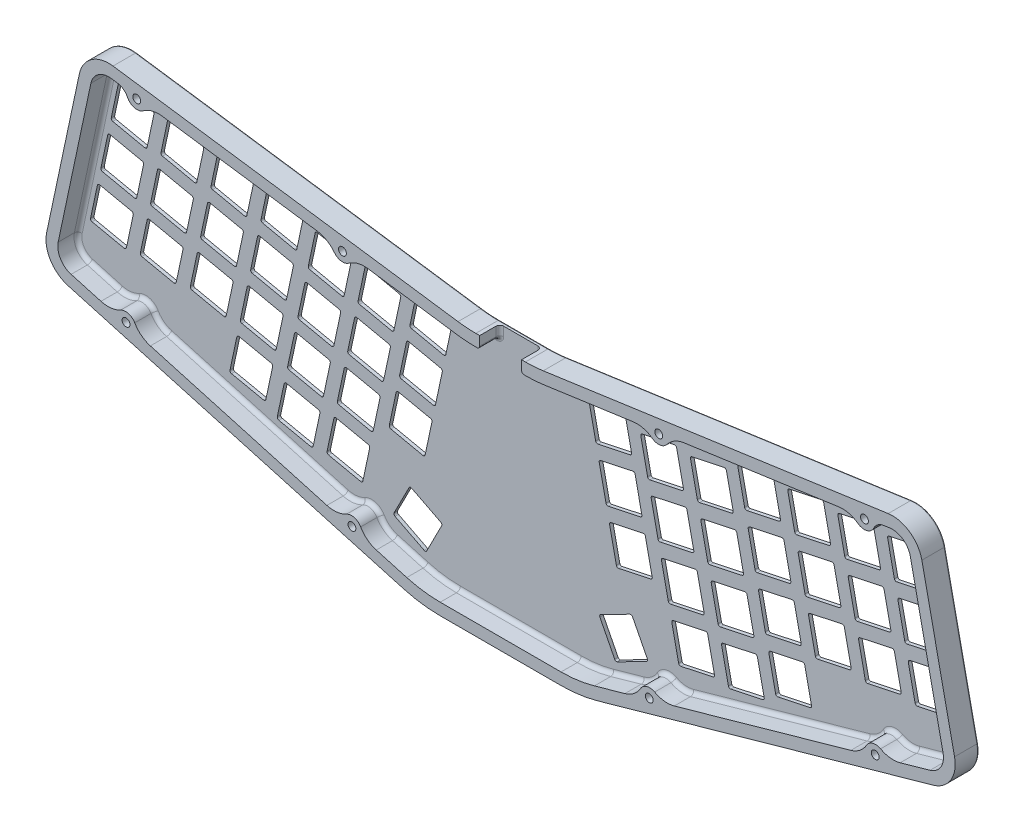
from build123d import *

# Parameters (mm, degrees)
MODEL_R             = 1.5
BOSS_EXTRUDE1_DEPTH = 9
BOSS_EXTRUDE2_DEPTH = 1.3
MODEL_4_R           = 1.5
BOSS_EXTRUDE3_DEPTH = 2
CUT_EXTRUDE1_DEPTH  = 10
FILLET2_R           = 1
FILLET3_R           = 1
FILLET4_R           = 1.5
FILLET6_R           = 0.5


with BuildPart() as part:
    # Model → Boss-Extrude1 (new body)
    with BuildSketch(Plane.XY):
        with BuildLine():
            ThreePointArc((176.403737975, 57.612801897), (173.012294783, 57.253677545), (169.603999044, 57.1337718))
            Line((169.603999044, 57.1337718), (150.648829756, 57.1337718))
            ThreePointArc((150.648829756, 57.1337718), (147.240534017, 57.253677545), (143.849090824, 57.612801897))
            Line((143.849090824, 57.612801897), (12.081352867, 76.271030157))
            ThreePointArc((12.081352867, 76.271030157), (3.877804033, 74.308284837), (-0.779653775, 67.275599046))
            Line((-0.779653775, 67.275599046), (-13.274730709, 8.490883588))
            ThreePointArc((-13.274730709, 8.490883588), (-11.871459071, 0.157038619), (-5.151125733, -4.967340667))
            Line((-5.151125733, -4.967340667), (123.055393281, -41.169431628))
            ThreePointArc((123.055393281, -41.169431628), (129.986107868, -42.620640598), (137.050372447, -43.1074446))
            Line((137.050372447, -43.1074446), (183.202456353, -43.1074446))
            ThreePointArc((183.202456353, -43.1074446), (190.266720932, -42.620640598), (197.197435519, -41.169431628))
            Line((197.197435519, -41.169431628), (325.403954533, -4.967340667))
            ThreePointArc((325.403954533, -4.967340667), (332.124287871, 0.157038619), (333.527559509, 8.490883588))
            Line((333.527559509, 8.490883588), (321.032482575, 67.275599045))
            ThreePointArc((321.032482575, 67.275599045), (316.375024767, 74.308284836), (308.171475933, 76.271030156))
            Line((308.171475933, 76.271030156), (176.403737975, 57.612801897))
        make_face()
        with Locations((103.335575354, -30.405568574)):
            Circle(MODEL_R, mode=Mode.SUBTRACT)
        with Locations((17.039281052, -6.037803815)):
            Circle(MODEL_R, mode=Mode.SUBTRACT)
        with Locations((216.917253446, -30.405568574)):
            Circle(MODEL_R, mode=Mode.SUBTRACT)
        with Locations((303.213547748, -6.037803815)):
            Circle(MODEL_R, mode=Mode.SUBTRACT)
        with Locations((21.146353911, 69.937554571)):
            Circle(MODEL_R, mode=Mode.SUBTRACT)
        with Locations((99.718342652, 58.811810716)):
            Circle(MODEL_R, mode=Mode.SUBTRACT)
        with BuildLine():
            Line((124.278255538, -36.838772567), (112.628950613, -33.549320519))
            ThreePointArc((112.628950613, -33.549320519), (109.193120681, -31.80832864), (106.670193349, -28.897861715))
            ThreePointArc((106.670193349, -28.897861715), (104.286690443, -27.037278193), (101.282051153, -27.376394512))
            ThreePointArc((101.282051153, -27.376394512), (97.609446415, -28.537408934), (93.770452927, -28.224185309))
            Line((93.770452927, -28.224185309), (26.332656311, -9.18155576))
            ThreePointArc((26.332656311, -9.18155576), (22.896826379, -7.440563881), (20.373899046, -4.530096956))
            ThreePointArc((20.373899046, -4.530096956), (17.99039614, -2.669513434), (14.98575685, -3.008629753))
            ThreePointArc((14.98575685, -3.008629753), (11.313152113, -4.169644175), (7.474158624, -3.85642055))
            Line((7.474158624, -3.85642055), (-3.928263476, -0.636681606))
            ThreePointArc((-3.928263476, -0.636681606), (-8.01890116, 2.482505785), (-8.873066505, 7.555280983))
            Line((-8.873066505, 7.555280983), (3.622010429, 66.339996442))
            ThreePointArc((3.622010429, 66.339996442), (6.456984747, 70.620761706), (11.450449255, 71.815476249))
            Line((11.450449255, 71.815476249), (13.807051559, 71.481782855))
            ThreePointArc((13.807051559, 71.481782855), (16.05801748, 70.566743382), (17.611829082, 68.698638909))
            ThreePointArc((17.611829082, 68.698638909), (20.250303311, 66.551050421), (23.587647853, 67.21121251))
            ThreePointArc((23.587647853, 67.21121251), (27.071325394, 68.854371308), (30.917639732, 69.058934404))
            Line((30.917639732, 69.058934404), (90.087257633, 60.680553975))
            ThreePointArc((90.087257633, 60.680553975), (93.725570339, 59.416172428), (96.616102068, 56.870429634))
            ThreePointArc((96.616102068, 56.870429634), (99.227639842, 55.346379898), (102.159636594, 56.085468655))
            ThreePointArc((102.159636594, 56.085468655), (105.643314135, 57.728627453), (109.489628473, 57.933190549))
            Line((109.489628473, 57.933190549), (143.218187212, 53.157247988))
            ThreePointArc((143.218187212, 53.157247988), (146.924300392, 52.76480282), (150.648829756, 52.6337718))
            Line((150.648829756, 52.6337718), (169.603999044, 52.6337718))
            ThreePointArc((169.603999044, 52.6337718), (173.328528408, 52.76480282), (177.034641588, 53.157247988))
            Line((177.034641588, 53.157247988), (210.763200327, 57.933190549))
            ThreePointArc((210.763200327, 57.933190549), (214.609514665, 57.728627453), (218.093192206, 56.085468655))
            ThreePointArc((218.093192206, 56.085468655), (221.025188958, 55.346379898), (223.636726732, 56.870429634))
            ThreePointArc((223.636726732, 56.870429634), (226.52725846, 59.416172428), (230.165571167, 60.680553974))
            Line((230.165571167, 60.680553974), (289.335189068, 69.058934403))
            ThreePointArc((289.335189068, 69.058934403), (293.181503406, 68.854371307), (296.665180948, 67.211212509))
            ThreePointArc((296.665180948, 67.211212509), (300.002525489, 66.55105042), (302.640999718, 68.698638908))
            ThreePointArc((302.640999718, 68.698638908), (304.19481132, 70.566743381), (306.445777241, 71.481782853))
            Line((306.445777241, 71.481782853), (308.802379545, 71.815476247))
            ThreePointArc((308.802379545, 71.815476247), (313.795844053, 70.620761705), (316.630818371, 66.339996441))
            Line((316.630818371, 66.339996441), (329.125895305, 7.555280983))
            ThreePointArc((329.125895305, 7.555280983), (328.27172996, 2.482505785), (324.181092276, -0.636681606))
            Line((324.181092276, -0.636681606), (312.778670176, -3.85642055))
            ThreePointArc((312.778670176, -3.85642055), (308.939676687, -4.169644175), (305.26707195, -3.008629753))
            ThreePointArc((305.26707195, -3.008629753), (302.26243266, -2.669513434), (299.878929754, -4.530096956))
            ThreePointArc((299.878929754, -4.530096956), (297.356002421, -7.440563881), (293.920172489, -9.18155576))
            Line((293.920172489, -9.18155576), (226.482375873, -28.224185309))
            ThreePointArc((226.482375873, -28.224185309), (222.643382385, -28.537408934), (218.970777647, -27.376394512))
            ThreePointArc((218.970777647, -27.376394512), (215.966138357, -27.037278193), (213.582635451, -28.897861715))
            ThreePointArc((213.582635451, -28.897861715), (211.059708119, -31.80832864), (207.623878187, -33.549320519))
            Line((207.623878187, -33.549320519), (195.974573262, -36.838772567))
            ThreePointArc((195.974573262, -36.838772567), (189.649455095, -38.16317687), (183.202456353, -38.6074446))
            Line((183.202456353, -38.6074446), (137.050372447, -38.6074446))
            ThreePointArc((137.050372447, -38.6074446), (130.603373705, -38.16317687), (124.278255538, -36.838772567))
        make_face(mode=Mode.SUBTRACT)
        with Locations((220.534486148, 58.811810716)):
            Circle(MODEL_R, mode=Mode.SUBTRACT)
        with Locations((299.10647489, 69.93755457)):
            Circle(MODEL_R, mode=Mode.SUBTRACT)
    extrude(amount=BOSS_EXTRUDE1_DEPTH)

    # Model<3> → Boss-Extrude2 (add)
    with BuildSketch(Plane.XY):
        with BuildLine():
            ThreePointArc((106.670193349, -28.897861715), (109.193120681, -31.80832864), (112.628950613, -33.549320519))
            Line((112.628950613, -33.549320519), (124.278255538, -36.838772567))
            ThreePointArc((124.278255538, -36.838772567), (130.603373705, -38.16317687), (137.050372447, -38.6074446))
            Line((137.050372447, -38.6074446), (160.1264144, -38.6074446))
            Line((160.1264144, -38.6074446), (183.202456353, -38.6074446))
            ThreePointArc((183.202456353, -38.6074446), (189.649455095, -38.16317687), (195.974573262, -36.838772567))
            Line((195.974573262, -36.838772567), (207.623878187, -33.549320519))
            ThreePointArc((207.623878187, -33.549320519), (211.059708119, -31.80832864), (213.582635451, -28.897861715))
            ThreePointArc((213.582635451, -28.897861715), (215.966138357, -27.037278193), (218.970777647, -27.376394512))
            ThreePointArc((218.970777647, -27.376394512), (222.643382385, -28.537408934), (226.482375873, -28.224185309))
            Line((226.482375873, -28.224185309), (271.948963849, -15.385637267))
            Line((271.948963849, -15.385637267), (293.920172489, -9.18155576))
            ThreePointArc((293.920172489, -9.18155576), (297.356002421, -7.440563881), (299.878929754, -4.530096956))
            ThreePointArc((299.878929754, -4.530096956), (302.26243266, -2.669513434), (305.26707195, -3.008629753))
            ThreePointArc((305.26707195, -3.008629753), (308.939676687, -4.169644175), (312.778670176, -3.85642055))
            Line((312.778670176, -3.85642055), (324.181092276, -0.636681606))
            ThreePointArc((324.181092276, -0.636681606), (328.27172996, 2.482505785), (329.125895305, 7.555280983))
            Line((329.125895305, 7.555280983), (322.378197452, 39.30070363))
            Line((322.378197452, 39.30070363), (316.630818371, 66.339996441))
            ThreePointArc((316.630818371, 66.339996441), (313.795844053, 70.620761705), (308.802379545, 71.815476247))
            Line((308.802379545, 71.815476247), (306.445777241, 71.481782853))
            ThreePointArc((306.445777241, 71.481782853), (304.19481132, 70.566743381), (302.640999718, 68.698638908))
            ThreePointArc((302.640999718, 68.698638908), (300.002525489, 66.55105042), (296.665180948, 67.211212509))
            ThreePointArc((296.665180948, 67.211212509), (293.181503406, 68.854371307), (289.335189068, 69.058934403))
            Line((289.335189068, 69.058934403), (230.165571167, 60.680553974))
            ThreePointArc((230.165571167, 60.680553974), (226.52725846, 59.416172428), (223.636726732, 56.870429634))
            ThreePointArc((223.636726732, 56.870429634), (221.025188958, 55.346379898), (218.093192206, 56.085468655))
            ThreePointArc((218.093192206, 56.085468655), (214.609514665, 57.728627453), (210.763200327, 57.933190549))
            Line((210.763200327, 57.933190549), (177.034641588, 53.157247988))
            ThreePointArc((177.034641588, 53.157247988), (173.328528408, 52.76480282), (169.603999044, 52.6337718))
            Line((169.603999044, 52.6337718), (150.648829756, 52.6337718))
            ThreePointArc((150.648829756, 52.6337718), (146.924300392, 52.76480282), (143.218187212, 53.157247988))
            Line((143.218187212, 53.157247988), (109.489628473, 57.933190549))
            ThreePointArc((109.489628473, 57.933190549), (105.643314135, 57.728627453), (102.159636594, 56.085468655))
            ThreePointArc((102.159636594, 56.085468655), (99.227639842, 55.346379898), (96.616102068, 56.870429634))
            ThreePointArc((96.616102068, 56.870429634), (93.725570339, 59.416172428), (90.087257633, 60.680553975))
            Line((90.087257633, 60.680553975), (30.917639732, 69.058934404))
            ThreePointArc((30.917639732, 69.058934404), (27.071325394, 68.854371308), (23.587647853, 67.21121251))
            ThreePointArc((23.587647853, 67.21121251), (20.250303311, 66.551050421), (17.611829082, 68.698638909))
            ThreePointArc((17.611829082, 68.698638909), (16.05801748, 70.566743382), (13.807051559, 71.481782855))
            Line((13.807051559, 71.481782855), (11.450449255, 71.815476249))
            ThreePointArc((11.450449255, 71.815476249), (6.456984747, 70.620761706), (3.622010429, 66.339996442))
            Line((3.622010429, 66.339996442), (-2.125368652, 39.30070363))
            Line((-2.125368652, 39.30070363), (-8.873066505, 7.555280983))
            ThreePointArc((-8.873066505, 7.555280983), (-8.01890116, 2.482505785), (-3.928263476, -0.636681606))
            Line((-3.928263476, -0.636681606), (7.474158624, -3.85642055))
            ThreePointArc((7.474158624, -3.85642055), (11.313152113, -4.169644175), (14.98575685, -3.008629753))
            ThreePointArc((14.98575685, -3.008629753), (17.99039614, -2.669513434), (20.373899046, -4.530096956))
            ThreePointArc((20.373899046, -4.530096956), (22.896826379, -7.440563881), (26.332656311, -9.18155576))
            Line((26.332656311, -9.18155576), (48.303864951, -15.385637267))
            Line((48.303864951, -15.385637267), (93.770452927, -28.224185309))
            ThreePointArc((93.770452927, -28.224185309), (97.609446415, -28.537408934), (101.282051153, -27.376394512))
            ThreePointArc((101.282051153, -27.376394512), (104.286690443, -27.037278193), (106.670193349, -28.897861715))
        make_face()
        with BuildLine():
            ThreePointArc((88.727862955, -5.824846865), (89.052994379, -5.351777707), (89.617407423, -5.247169932))
            Line((89.617407423, -5.247169932), (101.844252435, -7.846066055))
            ThreePointArc((101.844252435, -7.846066055), (102.317321593, -8.171197479), (102.421929368, -8.735610523))
            Line((102.421929368, -8.735610523), (99.823033245, -20.962455535))
            ThreePointArc((99.823033245, -20.962455535), (99.497901821, -21.435524693), (98.933488777, -21.540132468))
            Line((98.933488777, -21.540132468), (86.706643765, -18.941236345))
            ThreePointArc((86.706643765, -18.941236345), (86.233574607, -18.616104921), (86.128966832, -18.051691877))
            Line((86.128966832, -18.051691877), (88.727862955, -5.824846865))
        make_face(mode=Mode.SUBTRACT)
        with BuildLine():
            Line((123.222791405, -32.202255303), (117.65400063, -29.364814683))
            Line((117.65400063, -29.364814683), (112.08520985, -26.527374062))
            ThreePointArc((112.08520985, -26.527374062), (111.712410337, -26.090881916), (111.75744783, -25.518626297))
            Line((111.75744783, -25.518626297), (117.432329033, -14.381044722))
            ThreePointArc((117.432329033, -14.381044722), (117.86882118, -14.008245208), (118.441076802, -14.053282701))
            Line((118.441076802, -14.053282701), (129.578658358, -19.728163942))
            ThreePointArc((129.578658358, -19.728163942), (129.95145787, -20.164656088), (129.906420378, -20.736911707))
            Line((129.906420378, -20.736911707), (124.231539174, -31.874493282))
            ThreePointArc((124.231539174, -31.874493282), (123.795047027, -32.247292796), (123.222791405, -32.202255303))
        make_face(mode=Mode.SUBTRACT)
        with BuildLine():
            ThreePointArc((51.662209955, 2.564871135), (51.987341379, 3.037940293), (52.551754423, 3.142548068))
            Line((52.551754423, 3.142548068), (64.778599435, 0.543651945))
            ThreePointArc((64.778599435, 0.543651945), (65.251668593, 0.218520521), (65.356276368, -0.345892523))
            Line((65.356276368, -0.345892523), (62.757380245, -12.572737535))
            ThreePointArc((62.757380245, -12.572737535), (62.432248821, -13.045806693), (61.867835777, -13.150414468))
            Line((61.867835777, -13.150414468), (49.640990765, -10.551518345))
            ThreePointArc((49.640990765, -10.551518345), (49.167921607, -10.226386921), (49.063313832, -9.661973877))
            Line((49.063313832, -9.661973877), (51.662209955, 2.564871135))
        make_face(mode=Mode.SUBTRACT)
        with BuildLine():
            ThreePointArc((17.403364705, 24.159581835), (17.728496129, 24.632650993), (18.292909173, 24.737258768))
            Line((18.292909173, 24.737258768), (30.519754185, 22.138362645))
            ThreePointArc((30.519754185, 22.138362645), (30.992823343, 21.813231221), (31.097431118, 21.248818177))
            Line((31.097431118, 21.248818177), (28.498534995, 9.021973165))
            ThreePointArc((28.498534995, 9.021973165), (28.173403571, 8.548904007), (27.608990527, 8.444296232))
            Line((27.608990527, 8.444296232), (15.382145515, 11.043192355))
            ThreePointArc((15.382145515, 11.043192355), (14.909076357, 11.368323779), (14.804468582, 11.932736823))
            Line((14.804468582, 11.932736823), (17.403364705, 24.159581835))
        make_face(mode=Mode.SUBTRACT)
        with BuildLine():
            ThreePointArc((36.507948405, 22.654628735), (36.833079829, 23.127697893), (37.397492873, 23.232305668))
            Line((37.397492873, 23.232305668), (49.624337885, 20.633409545))
            ThreePointArc((49.624337885, 20.633409545), (50.097407043, 20.308278121), (50.202014818, 19.743865077))
            Line((50.202014818, 19.743865077), (47.603118695, 7.517020065))
            ThreePointArc((47.603118695, 7.517020065), (47.277987271, 7.043950907), (46.713574227, 6.939343132))
            Line((46.713574227, 6.939343132), (34.486729215, 9.538239255))
            ThreePointArc((34.486729215, 9.538239255), (34.013660057, 9.863370679), (33.909052282, 10.427783723))
            Line((33.909052282, 10.427783723), (36.507948405, 22.654628735))
        make_face(mode=Mode.SUBTRACT)
        with BuildLine():
            ThreePointArc((55.612532005, 21.149675635), (55.937663429, 21.622744793), (56.502076473, 21.727352568))
            Line((56.502076473, 21.727352568), (68.728921485, 19.128456445))
            ThreePointArc((68.728921485, 19.128456445), (69.201990643, 18.803325021), (69.306598418, 18.238911977))
            Line((69.306598418, 18.238911977), (66.707702295, 6.012066965))
            ThreePointArc((66.707702295, 6.012066965), (66.382570871, 5.538997807), (65.818157827, 5.434390032))
            Line((65.818157827, 5.434390032), (53.591312815, 8.033286155))
            ThreePointArc((53.591312815, 8.033286155), (53.118243657, 8.358417579), (53.013635882, 8.922830623))
            Line((53.013635882, 8.922830623), (55.612532005, 21.149675635))
        make_face(mode=Mode.SUBTRACT)
        with BuildLine():
            ThreePointArc((69.727235155, -3.830819965), (70.052366579, -3.357750807), (70.616779623, -3.253143032))
            Line((70.616779623, -3.253143032), (82.843624635, -5.852039155))
            ThreePointArc((82.843624635, -5.852039155), (83.316693793, -6.177170579), (83.421301568, -6.741583623))
            Line((83.421301568, -6.741583623), (80.822405445, -18.968428635))
            ThreePointArc((80.822405445, -18.968428635), (80.497274021, -19.441497793), (79.932860977, -19.546105568))
            Line((79.932860977, -19.546105568), (67.706015965, -16.947209445))
            ThreePointArc((67.706015965, -16.947209445), (67.232946807, -16.622078021), (67.128339032, -16.057664977))
            Line((67.128339032, -16.057664977), (69.727235155, -3.830819965))
        make_face(mode=Mode.SUBTRACT)
        with BuildLine():
            ThreePointArc((73.677557205, 14.753984435), (74.002688629, 15.227053593), (74.567101673, 15.331661368))
            Line((74.567101673, 15.331661368), (86.793946685, 12.732765245))
            ThreePointArc((86.793946685, 12.732765245), (87.267015843, 12.407633821), (87.371623618, 11.843220777))
            Line((87.371623618, 11.843220777), (84.772727495, -0.383624235))
            ThreePointArc((84.772727495, -0.383624235), (84.447596071, -0.856693393), (83.883183027, -0.961301168))
            Line((83.883183027, -0.961301168), (71.656338015, 1.637594955))
            ThreePointArc((71.656338015, 1.637594955), (71.183268857, 1.962726379), (71.078661082, 2.527139423))
            Line((71.078661082, 2.527139423), (73.677557205, 14.753984435))
        make_face(mode=Mode.SUBTRACT)
        with BuildLine():
            ThreePointArc((92.678185005, 12.759957535), (93.003316429, 13.233026693), (93.567729473, 13.337634468))
            Line((93.567729473, 13.337634468), (105.794574485, 10.738738345))
            ThreePointArc((105.794574485, 10.738738345), (106.267643643, 10.413606921), (106.372251418, 9.849193877))
            Line((106.372251418, 9.849193877), (103.773355295, -2.377651135))
            ThreePointArc((103.773355295, -2.377651135), (103.448223871, -2.850720293), (102.883810827, -2.955328068))
            Line((102.883810827, -2.955328068), (90.656965815, -0.356431945))
            ThreePointArc((90.656965815, -0.356431945), (90.183896657, -0.031300521), (90.079288882, 0.533112523))
            Line((90.079288882, 0.533112523), (92.678185005, 12.759957535))
        make_face(mode=Mode.SUBTRACT)
        with BuildLine():
            ThreePointArc((112.510459605, 14.678521035), (112.835591029, 15.151590193), (113.400004073, 15.256197968))
            Line((113.400004073, 15.256197968), (125.626849085, 12.657301845))
            ThreePointArc((125.626849085, 12.657301845), (126.099918243, 12.332170421), (126.204526018, 11.767757377))
            Line((126.204526018, 11.767757377), (123.605629895, -0.459087635))
            ThreePointArc((123.605629895, -0.459087635), (123.280498471, -0.932156793), (122.716085427, -1.036764568))
            Line((122.716085427, -1.036764568), (110.489240415, 1.562131555))
            ThreePointArc((110.489240415, 1.562131555), (110.016171257, 1.887262979), (109.911563482, 2.451676023))
            Line((109.911563482, 2.451676023), (112.510459605, 14.678521035))
        make_face(mode=Mode.SUBTRACT)
        with BuildLine():
            Line((208.16761895, -26.527374062), (202.59882817, -29.364814683))
            Line((202.59882817, -29.364814683), (197.030037395, -32.202255303))
            ThreePointArc((197.030037395, -32.202255303), (196.457781773, -32.247292796), (196.021289626, -31.874493282))
            Line((196.021289626, -31.874493282), (190.346408422, -20.736911707))
            ThreePointArc((190.346408422, -20.736911707), (190.30137093, -20.164656088), (190.674170442, -19.728163942))
            Line((190.674170442, -19.728163942), (201.811751998, -14.053282701))
            ThreePointArc((201.811751998, -14.053282701), (202.38400762, -14.008245208), (202.820499767, -14.381044722))
            Line((202.820499767, -14.381044722), (208.49538097, -25.518626297))
            ThreePointArc((208.49538097, -25.518626297), (208.540418463, -26.090881916), (208.16761895, -26.527374062))
        make_face(mode=Mode.SUBTRACT)
        with BuildLine():
            Line((218.408576365, -7.846066055), (230.635421377, -5.247169932))
            ThreePointArc((230.635421377, -5.247169932), (231.199834421, -5.351777707), (231.524965845, -5.824846865))
            Line((231.524965845, -5.824846865), (234.123861968, -18.051691877))
            ThreePointArc((234.123861968, -18.051691877), (234.019254193, -18.616104921), (233.546185035, -18.941236345))
            Line((233.546185035, -18.941236345), (221.319340023, -21.540132468))
            ThreePointArc((221.319340023, -21.540132468), (220.754926979, -21.435524693), (220.429795555, -20.962455535))
            Line((220.429795555, -20.962455535), (217.830899432, -8.735610523))
            ThreePointArc((217.830899432, -8.735610523), (217.935507207, -8.171197479), (218.408576365, -7.846066055))
        make_face(mode=Mode.SUBTRACT)
        with BuildLine():
            Line((237.409204165, -5.852039155), (249.636049177, -3.253143032))
            ThreePointArc((249.636049177, -3.253143032), (250.200462221, -3.357750807), (250.525593645, -3.830819965))
            Line((250.525593645, -3.830819965), (253.124489768, -16.057664977))
            ThreePointArc((253.124489768, -16.057664977), (253.019881993, -16.622078021), (252.546812835, -16.947209445))
            Line((252.546812835, -16.947209445), (240.319967823, -19.546105568))
            ThreePointArc((240.319967823, -19.546105568), (239.755554779, -19.441497793), (239.430423355, -18.968428635))
            Line((239.430423355, -18.968428635), (236.831527232, -6.741583623))
            ThreePointArc((236.831527232, -6.741583623), (236.936135007, -6.177170579), (237.409204165, -5.852039155))
        make_face(mode=Mode.SUBTRACT)
        with BuildLine():
            Line((194.625979715, 12.657301845), (206.852824727, 15.256197968))
            ThreePointArc((206.852824727, 15.256197968), (207.417237771, 15.151590193), (207.742369195, 14.678521035))
            Line((207.742369195, 14.678521035), (210.341265318, 2.451676023))
            ThreePointArc((210.341265318, 2.451676023), (210.236657543, 1.887262979), (209.763588385, 1.562131555))
            Line((209.763588385, 1.562131555), (197.536743373, -1.036764568))
            ThreePointArc((197.536743373, -1.036764568), (196.972330329, -0.932156793), (196.647198905, -0.459087635))
            Line((196.647198905, -0.459087635), (194.048302782, 11.767757377))
            ThreePointArc((194.048302782, 11.767757377), (194.152910557, 12.332170421), (194.625979715, 12.657301845))
        make_face(mode=Mode.SUBTRACT)
        with BuildLine():
            Line((214.458254315, 10.738738345), (226.685099327, 13.337634468))
            ThreePointArc((226.685099327, 13.337634468), (227.249512371, 13.233026693), (227.574643795, 12.759957535))
            Line((227.574643795, 12.759957535), (230.173539918, 0.533112523))
            ThreePointArc((230.173539918, 0.533112523), (230.068932143, -0.031300521), (229.595862985, -0.356431945))
            Line((229.595862985, -0.356431945), (217.369017973, -2.955328068))
            ThreePointArc((217.369017973, -2.955328068), (216.804604929, -2.850720293), (216.479473505, -2.377651135))
            Line((216.479473505, -2.377651135), (213.880577382, 9.849193877))
            ThreePointArc((213.880577382, 9.849193877), (213.985185157, 10.413606921), (214.458254315, 10.738738345))
        make_face(mode=Mode.SUBTRACT)
        with BuildLine():
            Line((233.458882115, 12.732765245), (245.685727127, 15.331661368))
            ThreePointArc((245.685727127, 15.331661368), (246.250140171, 15.227053593), (246.575271595, 14.753984435))
            Line((246.575271595, 14.753984435), (249.174167718, 2.527139423))
            ThreePointArc((249.174167718, 2.527139423), (249.069559943, 1.962726379), (248.596490785, 1.637594955))
            Line((248.596490785, 1.637594955), (236.369645773, -0.961301168))
            ThreePointArc((236.369645773, -0.961301168), (235.805232729, -0.856693393), (235.480101305, -0.383624235))
            Line((235.480101305, -0.383624235), (232.881205182, 11.843220777))
            ThreePointArc((232.881205182, 11.843220777), (232.985812957, 12.407633821), (233.458882115, 12.732765245))
        make_face(mode=Mode.SUBTRACT)
        with BuildLine():
            Line((255.474229365, 0.543651945), (267.701074377, 3.142548068))
            ThreePointArc((267.701074377, 3.142548068), (268.265487421, 3.037940293), (268.590618845, 2.564871135))
            Line((268.590618845, 2.564871135), (271.189514968, -9.661973877))
            ThreePointArc((271.189514968, -9.661973877), (271.084907193, -10.226386921), (270.611838035, -10.551518345))
            Line((270.611838035, -10.551518345), (258.384993023, -13.150414468))
            ThreePointArc((258.384993023, -13.150414468), (257.820579979, -13.045806693), (257.495448555, -12.572737535))
            Line((257.495448555, -12.572737535), (254.896552432, -0.345892523))
            ThreePointArc((254.896552432, -0.345892523), (255.001160207, 0.218520521), (255.474229365, 0.543651945))
        make_face(mode=Mode.SUBTRACT)
        with BuildLine():
            Line((251.523907315, 19.128456445), (263.750752327, 21.727352568))
            ThreePointArc((263.750752327, 21.727352568), (264.315165371, 21.622744793), (264.640296795, 21.149675635))
            Line((264.640296795, 21.149675635), (267.239192918, 8.922830623))
            ThreePointArc((267.239192918, 8.922830623), (267.134585143, 8.358417579), (266.661515985, 8.033286155))
            Line((266.661515985, 8.033286155), (254.434670973, 5.434390032))
            ThreePointArc((254.434670973, 5.434390032), (253.870257929, 5.538997807), (253.545126505, 6.012066965))
            Line((253.545126505, 6.012066965), (250.946230382, 18.238911977))
            ThreePointArc((250.946230382, 18.238911977), (251.050838157, 18.803325021), (251.523907315, 19.128456445))
        make_face(mode=Mode.SUBTRACT)
        with BuildLine():
            Line((270.628490915, 20.633409545), (282.855335927, 23.232305668))
            ThreePointArc((282.855335927, 23.232305668), (283.419748971, 23.127697893), (283.744880395, 22.654628735))
            Line((283.744880395, 22.654628735), (286.343776518, 10.427783723))
            ThreePointArc((286.343776518, 10.427783723), (286.239168743, 9.863370679), (285.766099585, 9.538239255))
            Line((285.766099585, 9.538239255), (273.539254573, 6.939343132))
            ThreePointArc((273.539254573, 6.939343132), (272.974841529, 7.043950907), (272.649710105, 7.517020065))
            Line((272.649710105, 7.517020065), (270.050813982, 19.743865077))
            ThreePointArc((270.050813982, 19.743865077), (270.155421757, 20.308278121), (270.628490915, 20.633409545))
        make_face(mode=Mode.SUBTRACT)
        with BuildLine():
            Line((289.733074615, 22.138362645), (301.959919627, 24.737258768))
            ThreePointArc((301.959919627, 24.737258768), (302.524332671, 24.632650993), (302.849464095, 24.159581835))
            Line((302.849464095, 24.159581835), (305.448360218, 11.932736823))
            ThreePointArc((305.448360218, 11.932736823), (305.343752443, 11.368323779), (304.870683285, 11.043192355))
            Line((304.870683285, 11.043192355), (292.643838273, 8.444296232))
            ThreePointArc((292.643838273, 8.444296232), (292.079425229, 8.548904007), (291.754293805, 9.021973165))
            Line((291.754293805, 9.021973165), (289.155397682, 21.248818177))
            ThreePointArc((289.155397682, 21.248818177), (289.260005457, 21.813231221), (289.733074615, 22.138362645))
        make_face(mode=Mode.SUBTRACT)
        with BuildLine():
            ThreePointArc((-1.597263045, 26.153608735), (-1.272131621, 26.626677893), (-0.707718577, 26.731285668))
            Line((-0.707718577, 26.731285668), (11.519126435, 24.132389545))
            ThreePointArc((11.519126435, 24.132389545), (11.992195593, 23.807258121), (12.096803368, 23.242845077))
            Line((12.096803368, 23.242845077), (9.497907245, 11.016000065))
            ThreePointArc((9.497907245, 11.016000065), (9.172775821, 10.542930907), (8.608362777, 10.438323132))
            Line((8.608362777, 10.438323132), (-3.618482235, 13.037219255))
            ThreePointArc((-3.618482235, 13.037219255), (-4.091551393, 13.362350679), (-4.196159168, 13.926763723))
            Line((-4.196159168, 13.926763723), (-1.597263045, 26.153608735))
        make_face(mode=Mode.SUBTRACT)
        with BuildLine():
            ThreePointArc((2.353059155, 44.738413135), (2.678190579, 45.211482293), (3.242603623, 45.316090068))
            Line((3.242603623, 45.316090068), (15.469448635, 42.717193945))
            ThreePointArc((15.469448635, 42.717193945), (15.942517793, 42.392062521), (16.047125568, 41.827649477))
            Line((16.047125568, 41.827649477), (13.448229445, 29.600804465))
            ThreePointArc((13.448229445, 29.600804465), (13.123098021, 29.127735307), (12.558684977, 29.023127532))
            Line((12.558684977, 29.023127532), (0.331839965, 31.622023655))
            ThreePointArc((0.331839965, 31.622023655), (-0.141229193, 31.947155079), (-0.245836968, 32.511568123))
            Line((-0.245836968, 32.511568123), (2.353059155, 44.738413135))
        make_face(mode=Mode.SUBTRACT)
        with BuildLine():
            ThreePointArc((21.353686905, 42.744386235), (21.678818329, 43.217455393), (22.243231373, 43.322063168))
            Line((22.243231373, 43.322063168), (34.470076385, 40.723167045))
            ThreePointArc((34.470076385, 40.723167045), (34.943145543, 40.398035621), (35.047753318, 39.833622577))
            Line((35.047753318, 39.833622577), (32.448857195, 27.606777565))
            ThreePointArc((32.448857195, 27.606777565), (32.123725771, 27.133708407), (31.559312727, 27.029100632))
            Line((31.559312727, 27.029100632), (19.332467715, 29.627996755))
            ThreePointArc((19.332467715, 29.627996755), (18.859398557, 29.953128179), (18.754790782, 30.517541223))
            Line((18.754790782, 30.517541223), (21.353686905, 42.744386235))
        make_face(mode=Mode.SUBTRACT)
        with BuildLine():
            ThreePointArc((40.458270605, 41.239433135), (40.783402029, 41.712502293), (41.347815073, 41.817110068))
            Line((41.347815073, 41.817110068), (53.574660085, 39.218213945))
            ThreePointArc((53.574660085, 39.218213945), (54.047729243, 38.893082521), (54.152337018, 38.328669477))
            Line((54.152337018, 38.328669477), (51.553440895, 26.101824465))
            ThreePointArc((51.553440895, 26.101824465), (51.228309471, 25.628755307), (50.663896427, 25.524147532))
            Line((50.663896427, 25.524147532), (38.437051415, 28.123043655))
            ThreePointArc((38.437051415, 28.123043655), (37.963982257, 28.448175079), (37.859374482, 29.012588123))
            Line((37.859374482, 29.012588123), (40.458270605, 41.239433135))
        make_face(mode=Mode.SUBTRACT)
        with BuildLine():
            ThreePointArc((59.562854205, 39.734480035), (59.887985629, 40.207549193), (60.452398673, 40.312156968))
            Line((60.452398673, 40.312156968), (72.679243685, 37.713260845))
            ThreePointArc((72.679243685, 37.713260845), (73.152312843, 37.388129421), (73.256920618, 36.823716377))
            Line((73.256920618, 36.823716377), (70.658024495, 24.596871365))
            ThreePointArc((70.658024495, 24.596871365), (70.332893071, 24.123802207), (69.768480027, 24.019194432))
            Line((69.768480027, 24.019194432), (57.541635015, 26.618090555))
            ThreePointArc((57.541635015, 26.618090555), (57.068565857, 26.943221979), (56.963958082, 27.507635023))
            Line((56.963958082, 27.507635023), (59.562854205, 39.734480035))
        make_face(mode=Mode.SUBTRACT)
        with BuildLine():
            ThreePointArc((96.628507205, 31.344761935), (96.953638629, 31.817831093), (97.518051673, 31.922438868))
            Line((97.518051673, 31.922438868), (109.744896685, 29.323542745))
            ThreePointArc((109.744896685, 29.323542745), (110.217965843, 28.998411321), (110.322573618, 28.433998277))
            Line((110.322573618, 28.433998277), (107.723677495, 16.207153265))
            ThreePointArc((107.723677495, 16.207153265), (107.398546071, 15.734084107), (106.834133027, 15.629476332))
            Line((106.834133027, 15.629476332), (94.607288015, 18.228372455))
            ThreePointArc((94.607288015, 18.228372455), (94.134218857, 18.553503879), (94.029611082, 19.117916923))
            Line((94.029611082, 19.117916923), (96.628507205, 31.344761935))
        make_face(mode=Mode.SUBTRACT)
        with BuildLine():
            ThreePointArc((77.627879405, 33.338788835), (77.953010829, 33.811857993), (78.517423873, 33.916465768))
            Line((78.517423873, 33.916465768), (90.744268885, 31.317569645))
            ThreePointArc((90.744268885, 31.317569645), (91.217338043, 30.992438221), (91.321945818, 30.428025177))
            Line((91.321945818, 30.428025177), (88.723049695, 18.201180165))
            ThreePointArc((88.723049695, 18.201180165), (88.397918271, 17.728111007), (87.833505227, 17.623503232))
            Line((87.833505227, 17.623503232), (75.606660215, 20.222399355))
            ThreePointArc((75.606660215, 20.222399355), (75.133591057, 20.547530779), (75.028983282, 21.111943823))
            Line((75.028983282, 21.111943823), (77.627879405, 33.338788835))
        make_face(mode=Mode.SUBTRACT)
        with BuildLine():
            ThreePointArc((116.460781805, 33.263325435), (116.785913229, 33.736394593), (117.350326273, 33.841002368))
            Line((117.350326273, 33.841002368), (129.577171285, 31.242106245))
            ThreePointArc((129.577171285, 31.242106245), (130.050240443, 30.916974821), (130.154848218, 30.352561777))
            Line((130.154848218, 30.352561777), (127.555952095, 18.125716765))
            ThreePointArc((127.555952095, 18.125716765), (127.230820671, 17.652647607), (126.666407627, 17.548039832))
            Line((126.666407627, 17.548039832), (114.439562615, 20.146935955))
            ThreePointArc((114.439562615, 20.146935955), (113.966493457, 20.472067379), (113.861885682, 21.036480423))
            Line((113.861885682, 21.036480423), (116.460781805, 33.263325435))
        make_face(mode=Mode.SUBTRACT)
        with BuildLine():
            ThreePointArc((81.578201505, 51.923593235), (81.903332929, 52.396662393), (82.467745973, 52.501270168))
            Line((82.467745973, 52.501270168), (94.694590985, 49.902374045))
            ThreePointArc((94.694590985, 49.902374045), (95.167660143, 49.577242621), (95.272267918, 49.012829577))
            Line((95.272267918, 49.012829577), (92.673371795, 36.785984565))
            ThreePointArc((92.673371795, 36.785984565), (92.348240371, 36.312915407), (91.783827327, 36.208307632))
            Line((91.783827327, 36.208307632), (79.556982315, 38.807203755))
            ThreePointArc((79.556982315, 38.807203755), (79.083913157, 39.132335179), (78.979305382, 39.696748223))
            Line((78.979305382, 39.696748223), (81.578201505, 51.923593235))
        make_face(mode=Mode.SUBTRACT)
        with BuildLine():
            ThreePointArc((100.578829305, 49.929566335), (100.903960729, 50.402635493), (101.468373773, 50.507243268))
            Line((101.468373773, 50.507243268), (113.695218785, 47.908347145))
            ThreePointArc((113.695218785, 47.908347145), (114.168287943, 47.583215721), (114.272895718, 47.018802677))
            Line((114.272895718, 47.018802677), (111.673999595, 34.791957665))
            ThreePointArc((111.673999595, 34.791957665), (111.348868171, 34.318888507), (110.784455127, 34.214280732))
            Line((110.784455127, 34.214280732), (98.557610115, 36.813176855))
            ThreePointArc((98.557610115, 36.813176855), (98.084540957, 37.138308279), (97.979933182, 37.702721323))
            Line((97.979933182, 37.702721323), (100.578829305, 49.929566335))
        make_face(mode=Mode.SUBTRACT)
        with BuildLine():
            ThreePointArc((133.527493385, 49.826910645), (134.000562543, 49.501779221), (134.105170318, 48.937366177))
            Line((134.105170318, 48.937366177), (131.506274195, 36.710521165))
            ThreePointArc((131.506274195, 36.710521165), (131.181142771, 36.237452007), (130.616729727, 36.132844232))
            Line((130.616729727, 36.132844232), (118.389884715, 38.731740355))
            ThreePointArc((118.389884715, 38.731740355), (117.916815557, 39.056871779), (117.812207782, 39.621284823))
            Line((117.812207782, 39.621284823), (120.411103905, 51.848129835))
            ThreePointArc((120.411103905, 51.848129835), (120.736235329, 52.321198993), (121.300648373, 52.425806768))
            Line((121.300648373, 52.425806768), (133.527493385, 49.826910645))
        make_face(mode=Mode.SUBTRACT)
        with BuildLine():
            ThreePointArc((6.303381255, 63.323217535), (6.628512679, 63.796286693), (7.192925723, 63.900894468))
            Line((7.192925723, 63.900894468), (19.419770735, 61.301998345))
            ThreePointArc((19.419770735, 61.301998345), (19.892839893, 60.976866921), (19.997447668, 60.412453877))
            Line((19.997447668, 60.412453877), (17.398551545, 48.185608865))
            ThreePointArc((17.398551545, 48.185608865), (17.073420121, 47.712539707), (16.509007077, 47.607931932))
            Line((16.509007077, 47.607931932), (4.282162065, 50.206828055))
            ThreePointArc((4.282162065, 50.206828055), (3.809092907, 50.531959479), (3.704485132, 51.096372523))
            Line((3.704485132, 51.096372523), (6.303381255, 63.323217535))
        make_face(mode=Mode.SUBTRACT)
        with BuildLine():
            ThreePointArc((25.304009005, 61.329190635), (25.629140429, 61.802259793), (26.193553473, 61.906867568))
            Line((26.193553473, 61.906867568), (38.420398485, 59.307971445))
            ThreePointArc((38.420398485, 59.307971445), (38.893467643, 58.982840021), (38.998075418, 58.418426977))
            Line((38.998075418, 58.418426977), (36.399179295, 46.191581965))
            ThreePointArc((36.399179295, 46.191581965), (36.074047871, 45.718512807), (35.509634827, 45.613905032))
            Line((35.509634827, 45.613905032), (23.282789815, 48.212801155))
            ThreePointArc((23.282789815, 48.212801155), (22.809720657, 48.537932579), (22.705112882, 49.102345623))
            Line((22.705112882, 49.102345623), (25.304009005, 61.329190635))
        make_face(mode=Mode.SUBTRACT)
        with BuildLine():
            ThreePointArc((44.408592705, 59.824237535), (44.733724129, 60.297306693), (45.298137173, 60.401914468))
            Line((45.298137173, 60.401914468), (57.524982185, 57.803018345))
            ThreePointArc((57.524982185, 57.803018345), (57.998051343, 57.477886921), (58.102659118, 56.913473877))
            Line((58.102659118, 56.913473877), (55.503762995, 44.686628865))
            ThreePointArc((55.503762995, 44.686628865), (55.178631571, 44.213559707), (54.614218527, 44.108951932))
            Line((54.614218527, 44.108951932), (42.387373515, 46.707848055))
            ThreePointArc((42.387373515, 46.707848055), (41.914304357, 47.032979479), (41.809696582, 47.597392523))
            Line((41.809696582, 47.597392523), (44.408592705, 59.824237535))
        make_face(mode=Mode.SUBTRACT)
        with BuildLine():
            ThreePointArc((63.513176305, 58.319284435), (63.838307729, 58.792353593), (64.402720773, 58.896961368))
            Line((64.402720773, 58.896961368), (76.629565785, 56.298065245))
            ThreePointArc((76.629565785, 56.298065245), (77.102634943, 55.972933821), (77.207242718, 55.408520777))
            Line((77.207242718, 55.408520777), (74.608346595, 43.181675765))
            ThreePointArc((74.608346595, 43.181675765), (74.283215171, 42.708606607), (73.718802127, 42.603998832))
            Line((73.718802127, 42.603998832), (61.491957115, 45.202894955))
            ThreePointArc((61.491957115, 45.202894955), (61.018887957, 45.528026379), (60.914280182, 46.092439423))
            Line((60.914280182, 46.092439423), (63.513176305, 58.319284435))
        make_face(mode=Mode.SUBTRACT)
        with BuildLine():
            Line((190.675657515, 31.242106245), (202.902502527, 33.841002368))
            ThreePointArc((202.902502527, 33.841002368), (203.466915571, 33.736394593), (203.792046995, 33.263325435))
            Line((203.792046995, 33.263325435), (206.390943118, 21.036480423))
            ThreePointArc((206.390943118, 21.036480423), (206.286335343, 20.472067379), (205.813266185, 20.146935955))
            Line((205.813266185, 20.146935955), (193.586421173, 17.548039832))
            ThreePointArc((193.586421173, 17.548039832), (193.022008129, 17.652647607), (192.696876705, 18.125716765))
            Line((192.696876705, 18.125716765), (190.097980582, 30.352561777))
            ThreePointArc((190.097980582, 30.352561777), (190.202588357, 30.916974821), (190.675657515, 31.242106245))
        make_face(mode=Mode.SUBTRACT)
        with BuildLine():
            Line((210.507932115, 29.323542745), (222.734777127, 31.922438868))
            ThreePointArc((222.734777127, 31.922438868), (223.299190171, 31.817831093), (223.624321595, 31.344761935))
            Line((223.624321595, 31.344761935), (226.223217718, 19.117916923))
            ThreePointArc((226.223217718, 19.117916923), (226.118609943, 18.553503879), (225.645540785, 18.228372455))
            Line((225.645540785, 18.228372455), (213.418695773, 15.629476332))
            ThreePointArc((213.418695773, 15.629476332), (212.854282729, 15.734084107), (212.529151305, 16.207153265))
            Line((212.529151305, 16.207153265), (209.930255182, 28.433998277))
            ThreePointArc((209.930255182, 28.433998277), (210.034862957, 28.998411321), (210.507932115, 29.323542745))
        make_face(mode=Mode.SUBTRACT)
        with BuildLine():
            Line((229.508559915, 31.317569645), (241.735404927, 33.916465768))
            ThreePointArc((241.735404927, 33.916465768), (242.299817971, 33.811857993), (242.624949395, 33.338788835))
            Line((242.624949395, 33.338788835), (245.223845518, 21.111943823))
            ThreePointArc((245.223845518, 21.111943823), (245.119237743, 20.547530779), (244.646168585, 20.222399355))
            Line((244.646168585, 20.222399355), (232.419323573, 17.623503232))
            ThreePointArc((232.419323573, 17.623503232), (231.854910529, 17.728111007), (231.529779105, 18.201180165))
            Line((231.529779105, 18.201180165), (228.930882982, 30.428025177))
            ThreePointArc((228.930882982, 30.428025177), (229.035490757, 30.992438221), (229.508559915, 31.317569645))
        make_face(mode=Mode.SUBTRACT)
        with BuildLine():
            Line((188.746554605, 36.710521165), (186.147658482, 48.937366177))
            ThreePointArc((186.147658482, 48.937366177), (186.252266257, 49.501779221), (186.725335415, 49.826910645))
            Line((186.725335415, 49.826910645), (198.952180427, 52.425806768))
            ThreePointArc((198.952180427, 52.425806768), (199.516593471, 52.321198993), (199.841724895, 51.848129835))
            Line((199.841724895, 51.848129835), (202.440621018, 39.621284823))
            ThreePointArc((202.440621018, 39.621284823), (202.336013243, 39.056871779), (201.862944085, 38.731740355))
            Line((201.862944085, 38.731740355), (189.636099073, 36.132844232))
            ThreePointArc((189.636099073, 36.132844232), (189.071686029, 36.237452007), (188.746554605, 36.710521165))
        make_face(mode=Mode.SUBTRACT)
        with BuildLine():
            Line((206.557610015, 47.908347145), (218.784455027, 50.507243268))
            ThreePointArc((218.784455027, 50.507243268), (219.348868071, 50.402635493), (219.673999495, 49.929566335))
            Line((219.673999495, 49.929566335), (222.272895618, 37.702721323))
            ThreePointArc((222.272895618, 37.702721323), (222.168287843, 37.138308279), (221.695218685, 36.813176855))
            Line((221.695218685, 36.813176855), (209.468373673, 34.214280732))
            ThreePointArc((209.468373673, 34.214280732), (208.903960629, 34.318888507), (208.578829205, 34.791957665))
            Line((208.578829205, 34.791957665), (205.979933082, 47.018802677))
            ThreePointArc((205.979933082, 47.018802677), (206.084540857, 47.583215721), (206.557610015, 47.908347145))
        make_face(mode=Mode.SUBTRACT)
        with BuildLine():
            Line((225.558237815, 49.902374045), (237.785082827, 52.501270168))
            ThreePointArc((237.785082827, 52.501270168), (238.349495871, 52.396662393), (238.674627295, 51.923593235))
            Line((238.674627295, 51.923593235), (241.273523418, 39.696748223))
            ThreePointArc((241.273523418, 39.696748223), (241.168915643, 39.132335179), (240.695846485, 38.807203755))
            Line((240.695846485, 38.807203755), (228.469001473, 36.208307632))
            ThreePointArc((228.469001473, 36.208307632), (227.904588429, 36.312915407), (227.579457005, 36.785984565))
            Line((227.579457005, 36.785984565), (224.980560882, 49.012829577))
            ThreePointArc((224.980560882, 49.012829577), (225.085168657, 49.577242621), (225.558237815, 49.902374045))
        make_face(mode=Mode.SUBTRACT)
        with BuildLine():
            Line((308.733702365, 24.132389545), (320.960547377, 26.731285668))
            ThreePointArc((320.960547377, 26.731285668), (321.524960421, 26.626677893), (321.850091845, 26.153608735))
            Line((321.850091845, 26.153608735), (324.448987968, 13.926763723))
            ThreePointArc((324.448987968, 13.926763723), (324.344380193, 13.362350679), (323.871311035, 13.037219255))
            Line((323.871311035, 13.037219255), (311.644466023, 10.438323132))
            ThreePointArc((311.644466023, 10.438323132), (311.080052979, 10.542930907), (310.754921555, 11.016000065))
            Line((310.754921555, 11.016000065), (308.156025432, 23.242845077))
            ThreePointArc((308.156025432, 23.242845077), (308.260633207, 23.807258121), (308.733702365, 24.132389545))
        make_face(mode=Mode.SUBTRACT)
        with BuildLine():
            Line((247.573585115, 37.713260845), (259.800430127, 40.312156968))
            ThreePointArc((259.800430127, 40.312156968), (260.364843171, 40.207549193), (260.689974595, 39.734480035))
            Line((260.689974595, 39.734480035), (263.288870718, 27.507635023))
            ThreePointArc((263.288870718, 27.507635023), (263.184262943, 26.943221979), (262.711193785, 26.618090555))
            Line((262.711193785, 26.618090555), (250.484348773, 24.019194432))
            ThreePointArc((250.484348773, 24.019194432), (249.919935729, 24.123802207), (249.594804305, 24.596871365))
            Line((249.594804305, 24.596871365), (246.995908182, 36.823716377))
            ThreePointArc((246.995908182, 36.823716377), (247.100515957, 37.388129421), (247.573585115, 37.713260845))
        make_face(mode=Mode.SUBTRACT)
        with BuildLine():
            Line((266.678168715, 39.218213945), (278.905013727, 41.817110068))
            ThreePointArc((278.905013727, 41.817110068), (279.469426771, 41.712502293), (279.794558195, 41.239433135))
            Line((279.794558195, 41.239433135), (282.393454318, 29.012588123))
            ThreePointArc((282.393454318, 29.012588123), (282.288846543, 28.448175079), (281.815777385, 28.123043655))
            Line((281.815777385, 28.123043655), (269.588932373, 25.524147532))
            ThreePointArc((269.588932373, 25.524147532), (269.024519329, 25.628755307), (268.699387905, 26.101824465))
            Line((268.699387905, 26.101824465), (266.100491782, 38.328669477))
            ThreePointArc((266.100491782, 38.328669477), (266.205099557, 38.893082521), (266.678168715, 39.218213945))
        make_face(mode=Mode.SUBTRACT)
        with BuildLine():
            Line((285.782752415, 40.723167045), (298.009597427, 43.322063168))
            ThreePointArc((298.009597427, 43.322063168), (298.574010471, 43.217455393), (298.899141895, 42.744386235))
            Line((298.899141895, 42.744386235), (301.498038018, 30.517541223))
            ThreePointArc((301.498038018, 30.517541223), (301.393430243, 29.953128179), (300.920361085, 29.627996755))
            Line((300.920361085, 29.627996755), (288.693516073, 27.029100632))
            ThreePointArc((288.693516073, 27.029100632), (288.129103029, 27.133708407), (287.803971605, 27.606777565))
            Line((287.803971605, 27.606777565), (285.205075482, 39.833622577))
            ThreePointArc((285.205075482, 39.833622577), (285.309683257, 40.398035621), (285.782752415, 40.723167045))
        make_face(mode=Mode.SUBTRACT)
        with BuildLine():
            Line((304.783380165, 42.717193945), (317.010225177, 45.316090068))
            ThreePointArc((317.010225177, 45.316090068), (317.574638221, 45.211482293), (317.899769645, 44.738413135))
            Line((317.899769645, 44.738413135), (320.498665768, 32.511568123))
            ThreePointArc((320.498665768, 32.511568123), (320.394057993, 31.947155079), (319.920988835, 31.622023655))
            Line((319.920988835, 31.622023655), (307.694143823, 29.023127532))
            ThreePointArc((307.694143823, 29.023127532), (307.129730779, 29.127735307), (306.804599355, 29.600804465))
            Line((306.804599355, 29.600804465), (304.205703232, 41.827649477))
            ThreePointArc((304.205703232, 41.827649477), (304.310311007, 42.392062521), (304.783380165, 42.717193945))
        make_face(mode=Mode.SUBTRACT)
        with BuildLine():
            Line((243.623263015, 56.298065245), (255.850108027, 58.896961368))
            ThreePointArc((255.850108027, 58.896961368), (256.414521071, 58.792353593), (256.739652495, 58.319284435))
            Line((256.739652495, 58.319284435), (259.338548618, 46.092439423))
            ThreePointArc((259.338548618, 46.092439423), (259.233940843, 45.528026379), (258.760871685, 45.202894955))
            Line((258.760871685, 45.202894955), (246.534026673, 42.603998832))
            ThreePointArc((246.534026673, 42.603998832), (245.969613629, 42.708606607), (245.644482205, 43.181675765))
            Line((245.644482205, 43.181675765), (243.045586082, 55.408520777))
            ThreePointArc((243.045586082, 55.408520777), (243.150193857, 55.972933821), (243.623263015, 56.298065245))
        make_face(mode=Mode.SUBTRACT)
        with BuildLine():
            Line((262.727846615, 57.803018345), (274.954691627, 60.401914468))
            ThreePointArc((274.954691627, 60.401914468), (275.519104671, 60.297306693), (275.844236095, 59.824237535))
            Line((275.844236095, 59.824237535), (278.443132218, 47.597392523))
            ThreePointArc((278.443132218, 47.597392523), (278.338524443, 47.032979479), (277.865455285, 46.707848055))
            Line((277.865455285, 46.707848055), (265.638610273, 44.108951932))
            ThreePointArc((265.638610273, 44.108951932), (265.074197229, 44.213559707), (264.749065805, 44.686628865))
            Line((264.749065805, 44.686628865), (262.150169682, 56.913473877))
            ThreePointArc((262.150169682, 56.913473877), (262.254777457, 57.477886921), (262.727846615, 57.803018345))
        make_face(mode=Mode.SUBTRACT)
        with BuildLine():
            Line((281.832430315, 59.307971445), (294.059275327, 61.906867568))
            ThreePointArc((294.059275327, 61.906867568), (294.623688371, 61.802259793), (294.948819795, 61.329190635))
            Line((294.948819795, 61.329190635), (297.547715918, 49.102345623))
            ThreePointArc((297.547715918, 49.102345623), (297.443108143, 48.537932579), (296.970038985, 48.212801155))
            Line((296.970038985, 48.212801155), (284.743193973, 45.613905032))
            ThreePointArc((284.743193973, 45.613905032), (284.178780929, 45.718512807), (283.853649505, 46.191581965))
            Line((283.853649505, 46.191581965), (281.254753382, 58.418426977))
            ThreePointArc((281.254753382, 58.418426977), (281.359361157, 58.982840021), (281.832430315, 59.307971445))
        make_face(mode=Mode.SUBTRACT)
        with BuildLine():
            Line((300.833058065, 61.301998345), (313.059903077, 63.900894468))
            ThreePointArc((313.059903077, 63.900894468), (313.624316121, 63.796286693), (313.949447545, 63.323217535))
            Line((313.949447545, 63.323217535), (316.548343668, 51.096372523))
            ThreePointArc((316.548343668, 51.096372523), (316.443735893, 50.531959479), (315.970666735, 50.206828055))
            Line((315.970666735, 50.206828055), (303.743821723, 47.607931932))
            ThreePointArc((303.743821723, 47.607931932), (303.179408679, 47.712539707), (302.854277255, 48.185608865))
            Line((302.854277255, 48.185608865), (300.255381132, 60.412453877))
            ThreePointArc((300.255381132, 60.412453877), (300.359988907, 60.976866921), (300.833058065, 61.301998345))
        make_face(mode=Mode.SUBTRACT)
    extrude(amount=BOSS_EXTRUDE2_DEPTH)

    # Model<4> → Boss-Extrude3 (add)
    with BuildSketch(Plane.XY):
        with Locations((103.335575354, -30.405568574)):
            Circle(MODEL_4_R)
        with Locations((216.917253446, -30.405568574)):
            Circle(MODEL_4_R)
        with Locations((99.718342652, 58.811810716)):
            Circle(MODEL_4_R)
        with Locations((220.534486148, 58.811810716)):
            Circle(MODEL_4_R)
        with Locations((17.039281052, -6.037803815)):
            Circle(MODEL_4_R)
        with Locations((303.213547748, -6.037803815)):
            Circle(MODEL_4_R)
        with Locations((299.10647489, 69.93755457)):
            Circle(MODEL_4_R)
        with Locations((21.146353911, 69.937554571)):
            Circle(MODEL_4_R)
    extrude(amount=BOSS_EXTRUDE3_DEPTH)

    # Sketch3 → Cut-Extrude1 (cut)
    with BuildSketch(Plane(origin=(0, 57.1337718, 0), x_dir=(1, 0, 0), z_dir=(0, 1, 0))):
        Polygon((160.1264144, -1.3), (168.1264144, -1.3), (168.1264144, -9), (160.1264144, -9), (152.1264144, -9), (152.1264144, -1.3), align=None)
    extrude(amount=-CUT_EXTRUDE1_DEPTH, mode=Mode.SUBTRACT)

    # Fillet2
    fillet2_edges = [part.edges().sort_by_distance(p)[0] for p in [
        (152.1264144, 52.6337718, 5.15),
    ]]
    fillet(fillet2_edges, radius=FILLET2_R)

    # Fillet3
    fillet3_edges = [part.edges().sort_by_distance(p)[0] for p in [
        (168.1264144, 52.6337718, 5.15),
    ]]
    fillet(fillet3_edges, radius=FILLET3_R)

    # Fillet4
    fillet4_edges = [part.edges().sort_by_distance(p)[0] for p in [
        (146.924300392, 52.76480282, 1.3),
    ]]
    fillet(fillet4_edges, radius=FILLET4_R)

    # Fillet6
    fillet6_edges = [part.edges().sort_by_distance(p)[0] for p in [
        (147.240534017, 57.253677545, 0),
        (160.1264144, 57.1337718, 0),
        (173.012294783, 57.253677545, 0),
        (242.287606954, 66.941916026, 0),
        (316.375024767, 74.308284836, 0),
        (327.280021042, 37.883241316, 0),
        (332.124287871, 0.157038619, 0),
        (261.300695026, -23.068386147, 0),
        (190.266720932, -42.620640598, 0),
        (160.1264144, -43.1074446, 0),
        (129.986107868, -42.620640598, 0),
        (58.952133774, -23.068386147, 0),
        (-11.871459071, 0.157038619, 0),
        (-7.027192242, 37.883241317, 0),
        (3.877804033, 74.308284837, 0),
        (77.965221846, 66.941916027, 0),
    ]]
    fillet(fillet6_edges, radius=FILLET6_R)


solid = part.part
